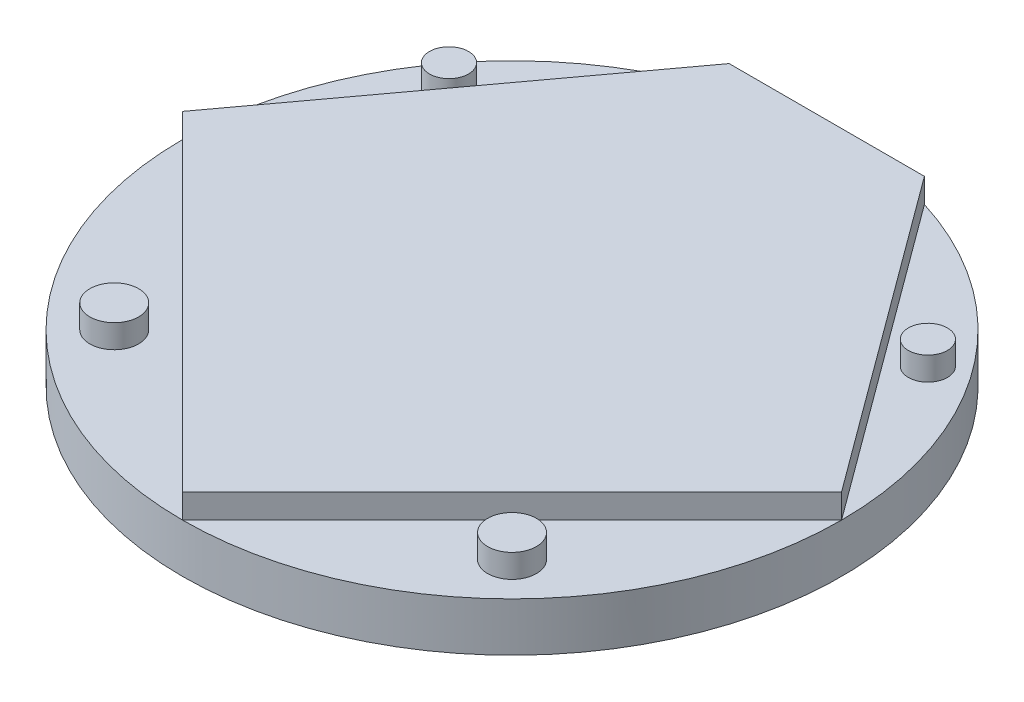
from build123d import *

# Parameters (mm, degrees)
SKETCH1_R           = 85.725
BOSS_EXTRUDE1_DEPTH = 12.7
BOSS_EXTRUDE2_DEPTH = 6.35
SKETCH3_R           = 6.35
SKETCH3_R_2         = 5.08
BOSS_EXTRUDE3_DEPTH = 6.096


with BuildPart() as part:
    # Sketch1 → Boss-Extrude1 (new body)
    with BuildSketch(Plane(origin=(0, 0, 0), x_dir=(1, 0, 0), z_dir=(0, 1, 0))):
        Circle(SKETCH1_R)
    extrude(amount=BOSS_EXTRUDE1_DEPTH)

    # Sketch2 → Boss-Extrude2 (add)
    with BuildSketch(Plane(origin=(0, 12.7, 0), x_dir=(1, 0, 0), z_dir=(0, 1, 0))):
        Polygon((-25.4, 81.875610685), (25.4, 81.875610685), (85.725, 0), (0, -85.725), (-85.725, 0), align=None)
    extrude(amount=BOSS_EXTRUDE2_DEPTH)

    # Sketch3 → Boss-Extrude3 (add)
    with BuildSketch(Plane(origin=(0, 12.7, 0), x_dir=(1, 0, 0), z_dir=(0, 1, 0))):
        with Locations((-51.739614409, -51.739614409)):
            Circle(SKETCH3_R)
        with Locations((51.739614409, -51.739614409)):
            Circle(SKETCH3_R)
        with Locations((62.288840877, 45.893695259)):
            Circle(SKETCH3_R_2)
        with Locations((-62.288840877, 45.893695259)):
            Circle(SKETCH3_R_2)
    extrude(amount=BOSS_EXTRUDE3_DEPTH)


solid = part.part
